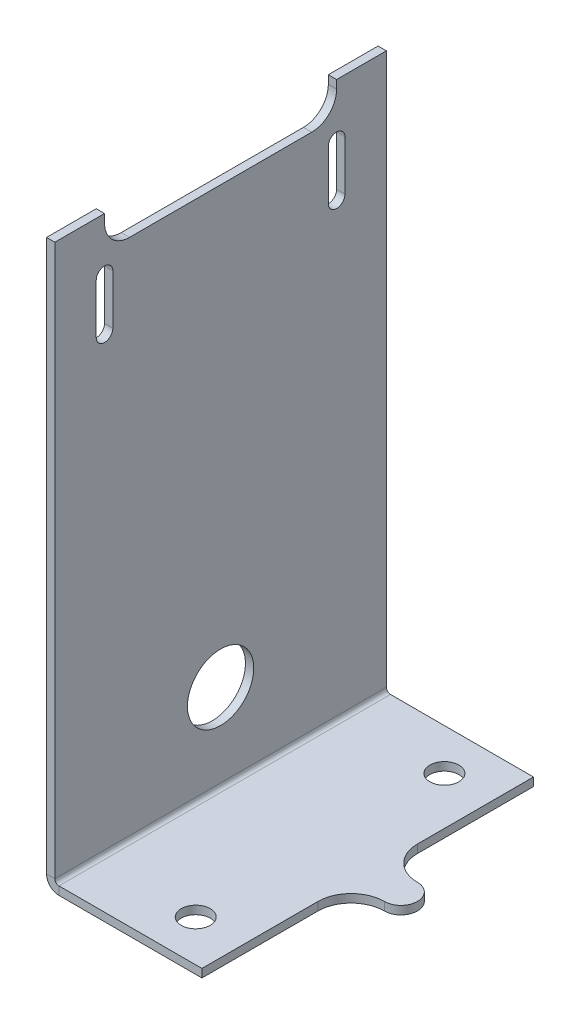
from build123d import *

# Parameters (mm, degrees)
EXTRUDE1_DEPTH             = 63.5
EXTRUDE1_DEPTH_BACK        = 63.5
CUT_EXTRUDE2_REACH         = 230.798
SKETCH2_R                  = 5.55625
EXTRUDE2_DEPTH             = 3.175
CUT_EXTRUDE3_REACH         = 237.498
SKETCH4_R                  = 12.7
CUT_EXTRUDE4_DEPTH         = 236.497746224
FILLET1_R                  = 9.525
CUT_EXTRUDE7_REACH         = 237.498
FLATTEN_BENDS1_OUTLINE_W   = 4.987278338
FLATTEN_BENDS1_OUTLINE_H   = 127
FLATTEN_BENDS1_DEPTH       = 212.725
FLATTEN_BENDS1_START       = -3.175
FLATTEN_BENDS1_2_OUTLINE_R = 12.7
FLATTEN_BENDS1_2_DEPTH     = 3.175
PROCESS_BENDS1_START       = -252.637278338
PROCESS_BENDS1_OUTLINE_W   = 3.175
PROCESS_BENDS1_OUTLINE_H   = 127
PROCESS_BENDS1_DEPTH       = 211.622562692
PROCESS_BENDS1_START_2     = -41.275
PROCESS_BENDS1_2_OUTLINE_W = 3.175
PROCESS_BENDS1_2_OUTLINE_H = 6.35
PROCESS_BENDS1_2_DEPTH     = 0.287614639
PROCESS_BENDS1_START_3     = -40.987385361
PROCESS_BENDS1_3_OUTLINE_R = 12.7
PROCESS_BENDS1_3_DEPTH     = 2.887385361
PROCESS_BENDS1_4_OUTLINE_R = 12.7
PROCESS_BENDS1_4_DEPTH     = 4.7625
PROCESS_BENDS1_START_4     = -64
PROCESS_BENDS1_5_DEPTH     = 128
PROCESS_BENDS1_START_5     = -47.625
PROCESS_BENDS1_6_DEPTH     = 95.25


with BuildPart() as part:
    # Sketch1 → Extrude1 (new, two sides: drawn at the far end of the back side and taken through both)
    with BuildSketch(Plane.XY.offset(-EXTRUDE1_DEPTH_BACK)):
        with BuildLine():
            Line((18.25625, 0), (-36.5125, 0))
            ThreePointArc((-36.5125, 0), (-37.635032015, 0.464967985), (-38.1, 1.5875))
            Line((-38.1, 1.5875), (-38.1, 212.725))
            Line((-38.1, 212.725), (-41.275, 212.725))
            Line((-41.275, 212.725), (-41.275, 1.5875))
            ThreePointArc((-41.275, 1.5875), (-39.880096045, -1.780096045), (-36.5125, -3.175))
            Line((-36.5125, -3.175), (18.25625, -3.175))
            Line((18.25625, -3.175), (18.25625, 0))
        make_face()
    extrude(amount=EXTRUDE1_DEPTH + EXTRUDE1_DEPTH_BACK)

    # Sketch2 → Cut-Extrude2 (cut, up to next)
    with BuildSketch(Plane.XZ.offset(3.175), mode=Mode.PRIVATE) as cut_extrude2_sk1:
        with Locations((0, -47.625)):
            Circle(SKETCH2_R)
    cut_extrude2_tool1 = extrude(cut_extrude2_sk1.sketch, amount=-CUT_EXTRUDE2_REACH, mode=Mode.PRIVATE) & part.part
    # Sketch2 → Cut-Extrude2 (cut, up to next)
    with BuildSketch(Plane.XZ.offset(3.175), mode=Mode.PRIVATE) as cut_extrude2_sk2:
        with Locations((0, 47.625)):
            Circle(SKETCH2_R)
    cut_extrude2_tool2 = extrude(cut_extrude2_sk2.sketch, amount=-CUT_EXTRUDE2_REACH, mode=Mode.PRIVATE) & part.part
    add(cut_extrude2_tool1.solids().sort_by_distance((0, -3.175, -47.625))[0], mode=Mode.SUBTRACT)
    add(cut_extrude2_tool2.solids().sort_by_distance((0, -3.175, 47.625))[0], mode=Mode.SUBTRACT)

    # Sketch3 → Extrude2 (add)
    with BuildSketch(Plane.XZ.offset(3.175)):
        with BuildLine():
            Line((18.25625, -19.05), (18.25625, 19.05))
            ThreePointArc((18.25625, 19.05), (21.975993879, 10.069743879), (30.95625, 6.35))
            ThreePointArc((30.95625, 6.35), (37.30625, 0), (30.95625, -6.35))
            ThreePointArc((30.95625, -6.35), (21.975993879, -10.069743879), (18.25625, -19.05))
        make_face()
    extrude(amount=-EXTRUDE2_DEPTH)

    # Sketch4 → Cut-Extrude3 (cut, up to next)
    with BuildSketch(Plane.ZY.offset(41.275), mode=Mode.PRIVATE) as cut_extrude3_sk1:
        with Locations((0, 33.3375)):
            Circle(SKETCH4_R)
    cut_extrude3_tool1 = extrude(cut_extrude3_sk1.sketch, amount=-CUT_EXTRUDE3_REACH, mode=Mode.PRIVATE) & part.part
    add(cut_extrude3_tool1.solids().sort_by_distance((-41.275, 33.3375, 0))[0], mode=Mode.SUBTRACT)

    # Sketch5 → Cut-Extrude4 (cut, through all)
    with BuildSketch(Plane.ZY.offset(41.275)):
        Polygon((44.45, 705.492076342), (44.45, 212.725), (44.45, 200.025), (-44.45, 200.025), (-44.45, 212.725), (-44.45, 705.492076342), (-44.45, 1691.026229027), (44.45, 1691.026229027), align=None)
    extrude(amount=-CUT_EXTRUDE4_DEPTH, mode=Mode.SUBTRACT)

    # Fillet1
    fillet1_edges = [part.edges().sort_by_distance(p)[0] for p in [
        (-39.6875, 200.025, 44.45),
        (-39.6875, 200.025, -44.45),
    ]]
    fillet(fillet1_edges, radius=FILLET1_R)

    # Sketch6 → Cut-Extrude7 (cut, up to next)
    with BuildSketch(Plane.ZY.offset(41.275), mode=Mode.PRIVATE) as cut_extrude7_sk1:
        with BuildLine():
            Line((-47.625, 192.151), (-47.625, 173.101))
            ThreePointArc((-47.625, 173.101), (-44.45, 169.926), (-41.275, 173.101))
            Line((-41.275, 173.101), (-41.275, 192.151))
            ThreePointArc((-41.275, 192.151), (-44.45, 195.326), (-47.625, 192.151))
        make_face()
    cut_extrude7_tool1 = extrude(cut_extrude7_sk1.sketch, amount=-CUT_EXTRUDE7_REACH, mode=Mode.PRIVATE) & part.part
    # Sketch6 → Cut-Extrude7 (cut, up to next)
    with BuildSketch(Plane.ZY.offset(41.275), mode=Mode.PRIVATE) as cut_extrude7_sk2:
        with BuildLine():
            Line((47.625, 173.101), (47.625, 192.151))
            ThreePointArc((47.625, 192.151), (44.45, 195.326), (41.275, 192.151))
            Line((41.275, 192.151), (41.275, 173.101))
            ThreePointArc((41.275, 173.101), (44.45, 169.926), (47.625, 173.101))
        make_face()
    cut_extrude7_tool2 = extrude(cut_extrude7_sk2.sketch, amount=-CUT_EXTRUDE7_REACH, mode=Mode.PRIVATE) & part.part
    add(cut_extrude7_tool1.solids().sort_by_distance((-41.275, 182.626, -44.45))[0], mode=Mode.SUBTRACT)
    add(cut_extrude7_tool2.solids().sort_by_distance((-41.275, 182.626, 44.45))[0], mode=Mode.SUBTRACT)

    # Flatten-Bends1: read off the stored shape, not the designer's step
    # Flatten-Bends1 outline → Flatten-Bends1 (cut)
    with BuildSketch(Plane(origin=(0, 0, 0), x_dir=(1, 0, 0), z_dir=(0, 1, 0))):
        with Locations((-39.006139169, 0)):
            Rectangle(FLATTEN_BENDS1_OUTLINE_W, FLATTEN_BENDS1_OUTLINE_H)
    extrude(amount=FLATTEN_BENDS1_DEPTH, mode=Mode.SUBTRACT)

    # Flatten-Bends1 2 outline → Flatten-Bends1 2 (add)
    with BuildSketch(Plane(origin=(0, 0, 0), x_dir=(1, 0, 0), z_dir=(0, 1, 0)).offset(FLATTEN_BENDS1_START)):
        with BuildLine():
            Line((-252.637278338, -44.45), (-252.637278338, -63.5))
            Line((-252.637278338, -63.5), (-36.5125, -63.5))
            Line((-36.5125, -63.5), (-36.5125, 63.5))
            Line((-36.5125, 63.5), (-252.637278338, 63.5))
            Line((-252.637278338, 63.5), (-252.637278338, 44.45))
            Line((-252.637278338, 44.45), (-249.462278338, 44.45))
            ThreePointArc((-249.462278338, 44.45), (-242.727086247, 41.660192091), (-239.937278338, 34.925))
            Line((-239.937278338, 34.925), (-239.937278338, -34.925))
            ThreePointArc((-239.937278338, -34.925), (-242.727086247, -41.660192091), (-249.462278338, -44.45))
            Line((-249.462278338, -44.45), (-252.637278338, -44.45))
        make_face()
        with BuildLine():
            Line((-213.013278338, -47.625), (-232.063278338, -47.625))
            ThreePointArc((-232.063278338, -47.625), (-235.238278338, -44.45), (-232.063278338, -41.275))
            Line((-232.063278338, -41.275), (-213.013278338, -41.275))
            ThreePointArc((-213.013278338, -41.275), (-209.838278338, -44.45), (-213.013278338, -47.625))
        make_face(mode=Mode.SUBTRACT)
        with Locations((-73.249778338, 0)):
            Circle(FLATTEN_BENDS1_2_OUTLINE_R, mode=Mode.SUBTRACT)
        with BuildLine():
            Line((-232.063278338, 47.625), (-213.013278338, 47.625))
            ThreePointArc((-213.013278338, 47.625), (-209.838278338, 44.45), (-213.013278338, 41.275))
            Line((-213.013278338, 41.275), (-232.063278338, 41.275))
            ThreePointArc((-232.063278338, 41.275), (-235.238278338, 44.45), (-232.063278338, 47.625))
        make_face(mode=Mode.SUBTRACT)
    extrude(amount=FLATTEN_BENDS1_2_DEPTH)

    # Process-Bends1: read off the stored shape, not the designer's step
    # Process-Bends1 outline → Process-Bends1 (cut)
    with BuildSketch(Plane.YZ.offset(PROCESS_BENDS1_START)):
        with Locations((-1.5875, 0)):
            Rectangle(PROCESS_BENDS1_OUTLINE_W, PROCESS_BENDS1_OUTLINE_H)
    extrude(amount=PROCESS_BENDS1_DEPTH, mode=Mode.SUBTRACT)

    # Process-Bends1 2 outline → Process-Bends1 2 (cut)
    with BuildSketch(Plane.YZ.offset(PROCESS_BENDS1_START_2)):
        with Locations((-1.5875, -44.45)):
            Rectangle(PROCESS_BENDS1_2_OUTLINE_W, PROCESS_BENDS1_2_OUTLINE_H)
        with Locations((-1.5875, 44.45)):
            Rectangle(PROCESS_BENDS1_2_OUTLINE_W, PROCESS_BENDS1_2_OUTLINE_H)
    extrude(amount=PROCESS_BENDS1_2_DEPTH, mode=Mode.SUBTRACT)

    # Process-Bends1 3 outline → Process-Bends1 3 (add)
    with BuildSketch(Plane.YZ.offset(PROCESS_BENDS1_START_3)):
        with BuildLine():
            Line((212.725, -44.45), (209.55, -44.45))
            ThreePointArc((209.55, -44.45), (202.814807909, -41.660192091), (200.025, -34.925))
            Line((200.025, -34.925), (200.025, 34.925))
            ThreePointArc((200.025, 34.925), (202.814807909, 41.660192091), (209.55, 44.45))
            Line((209.55, 44.45), (212.725, 44.45))
            Line((212.725, 44.45), (212.725, 63.5))
            Line((212.725, 63.5), (0, 63.5))
            Line((0, 63.5), (0, -63.5))
            Line((0, -63.5), (212.725, -63.5))
            Line((212.725, -63.5), (212.725, -44.45))
        make_face()
        with BuildLine():
            Line((192.151, -47.625), (173.101, -47.625))
            ThreePointArc((173.101, -47.625), (169.926, -44.45), (173.101, -41.275))
            Line((173.101, -41.275), (192.151, -41.275))
            ThreePointArc((192.151, -41.275), (195.326, -44.45), (192.151, -47.625))
        make_face(mode=Mode.SUBTRACT)
        with Locations((33.3375, 0)):
            Circle(PROCESS_BENDS1_3_OUTLINE_R, mode=Mode.SUBTRACT)
        with BuildLine():
            Line((192.151, 41.275), (173.101, 41.275))
            ThreePointArc((173.101, 41.275), (169.926, 44.45), (173.101, 47.625))
            Line((173.101, 47.625), (192.151, 47.625))
            ThreePointArc((192.151, 47.625), (195.326, 44.45), (192.151, 41.275))
        make_face(mode=Mode.SUBTRACT)
    extrude(amount=PROCESS_BENDS1_3_DEPTH)

    # Process-Bends1 4 outline → Process-Bends1 4 (add)
    with BuildSketch(Plane.YZ.offset(PROCESS_BENDS1_START_2)):
        with BuildLine():
            Line((212.725, 63.5), (0, 63.5))
            Line((0, 63.5), (0, -63.5))
            Line((0, -63.5), (212.725, -63.5))
            Line((212.725, -63.5), (212.725, -44.45))
            Line((212.725, -44.45), (209.55, -44.45))
            ThreePointArc((209.55, -44.45), (202.814807909, -41.660192091), (200.025, -34.925))
            Line((200.025, -34.925), (200.025, 34.925))
            ThreePointArc((200.025, 34.925), (202.814807909, 41.660192091), (209.55, 44.45))
            Line((209.55, 44.45), (212.725, 44.45))
            Line((212.725, 44.45), (212.725, 63.5))
        make_face()
        with BuildLine():
            Line((192.151, -47.625), (173.101, -47.625))
            ThreePointArc((173.101, -47.625), (169.926, -44.45), (173.101, -41.275))
            Line((173.101, -41.275), (192.151, -41.275))
            ThreePointArc((192.151, -41.275), (195.326, -44.45), (192.151, -47.625))
        make_face(mode=Mode.SUBTRACT)
        with Locations((33.3375, 0)):
            Circle(PROCESS_BENDS1_4_OUTLINE_R, mode=Mode.SUBTRACT)
        with BuildLine():
            Line((192.151, 41.275), (173.101, 41.275))
            ThreePointArc((173.101, 41.275), (169.926, 44.45), (173.101, 47.625))
            Line((173.101, 47.625), (192.151, 47.625))
            ThreePointArc((192.151, 47.625), (195.326, 44.45), (192.151, 41.275))
        make_face(mode=Mode.SUBTRACT)
    extrude(amount=PROCESS_BENDS1_4_DEPTH)

    # Process-Bends1 5 outline → Process-Bends1 5 (cut)
    with BuildSketch(Plane.XY.offset(PROCESS_BENDS1_START_4)):
        with BuildLine():
            Line((-36.5125, 212.725), (-38.1, 212.725))
            Line((-38.1, 212.725), (-38.1, 1.5875))
            ThreePointArc((-38.1, 1.5875), (-37.635032015, 0.464967985), (-36.5125, 0))
            Line((-36.5125, 0), (-36.5125, 212.725))
        make_face()
        with BuildLine():
            Line((-41.275, 1.5875), (-41.275, 0))
            Line((-41.275, 0), (-41.014715646, 0))
            Line((-41.014715646, 0), (-41.014715646, -3.175))
            Line((-41.014715646, -3.175), (-36.5125, -3.175))
            ThreePointArc((-36.5125, -3.175), (-39.880096045, -1.780096045), (-41.275, 1.5875))
        make_face()
    extrude(amount=PROCESS_BENDS1_5_DEPTH, mode=Mode.SUBTRACT)

    # Process-Bends1 6 outline → Process-Bends1 6 (add)
    with BuildSketch(Plane.XY.offset(PROCESS_BENDS1_START_5)):
        with BuildLine():
            Line((-40.987385361, 0), (-41.00262806, 0))
            ThreePointArc((-41.00262806, 0), (-40.995057012, -0.021253828), (-40.987385361, -0.04247155))
            Line((-40.987385361, -0.04247155), (-40.987385361, 0))
        make_face()
    extrude(amount=PROCESS_BENDS1_6_DEPTH)


solid = part.part
